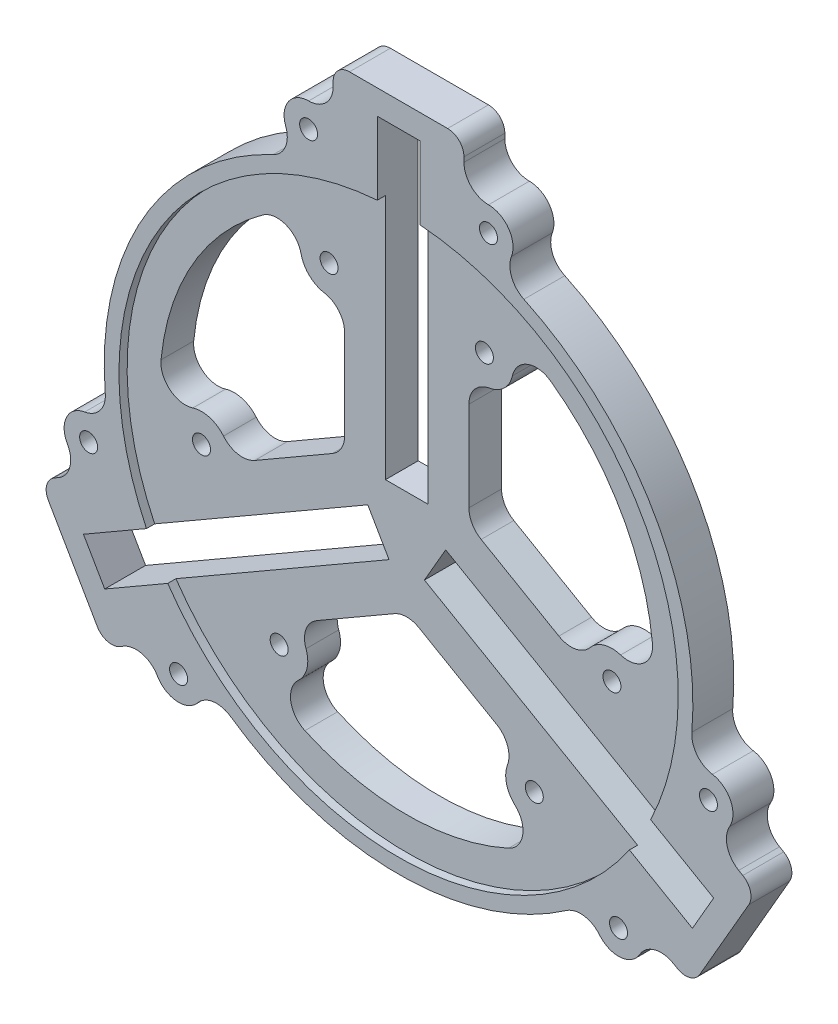
from build123d import *

# Parameters (mm, degrees)
SKETCH1_W           = 5.2
SKETCH1_H           = 39
BOSS_EXTRUDE1_DEPTH = 5
BOSS_EXTRUDE2_DEPTH = 5
SKETCH3_R           = 34.2
CUT_EXTRUDE1_DEPTH  = 1
CUT_EXTRUDE2_REACH  = 65.739
SKETCH4_R           = 1.1
FILLET1_R           = 2
CUT_EXTRUDE3_REACH  = 65.167
FILLET2_R           = 3
SKETCH6_R           = 1.1
BOSS_EXTRUDE3_DEPTH = 5
FILLET3_R           = 3


with BuildPart() as part:
    # Sketch1 → Boss-Extrude1 (new body)
    with BuildSketch(Plane.XY):
        Polygon((-8, 46), (8, 46), (8, 35), (34.310889132, -10.57179677), (43.837168574, -16.07179677), (35.837168574, -29.92820323), (26.310889132, -24.42820323), (-26.310889132, -24.42820323), (-35.837168574, -29.92820323), (-43.837168574, -16.07179677), (-34.310889132, -10.57179677), (-8, 35), align=None)
        Polygon((4.764101615, 0.25166605), (2.164101615, -4.25166605), (35.939092363, -23.75166605), (38.539092363, -19.24833395), align=None, mode=Mode.SUBTRACT)
        with Locations((0, 23.5)):
            Rectangle(SKETCH1_W, SKETCH1_H, mode=Mode.SUBTRACT)
        Polygon((-2.164101615, -4.25166605), (-4.764101615, 0.25166605), (-38.539092363, -19.24833395), (-35.939092363, -23.75166605), align=None, mode=Mode.SUBTRACT)
    extrude(amount=BOSS_EXTRUDE1_DEPTH)

    # Sketch2 → Boss-Extrude2 (add)
    with BuildSketch(Plane.XY.offset(5)):
        with BuildLine():
            Line((34.310889132, -10.57179677), (8, 35))
            Line((8, 35), (8, 35.09985755))
            ThreePointArc((8, 35.09985755), (31.176914536, 18), (34.397368307, -10.621725545))
            Line((34.397368307, -10.621725545), (34.310889132, -10.57179677))
        make_face()
        with BuildLine():
            Line((-26.310889132, -24.42820323), (26.310889132, -24.42820323))
            Line((26.310889132, -24.42820323), (26.397368307, -24.478132005))
            ThreePointArc((26.397368307, -24.478132005), (0, -36), (-26.397368307, -24.478132005))
            Line((-26.397368307, -24.478132005), (-26.310889132, -24.42820323))
        make_face()
        with BuildLine():
            Line((-8, 35), (-34.310889132, -10.57179677))
            Line((-34.310889132, -10.57179677), (-34.397368307, -10.621725545))
            ThreePointArc((-34.397368307, -10.621725545), (-31.176914536, 18), (-8, 35.09985755))
            Line((-8, 35.09985755), (-8, 35))
        make_face()
    extrude(amount=-BOSS_EXTRUDE2_DEPTH)

    # Sketch3 → Cut-Extrude1 (cut)
    with BuildSketch(Plane.XY.offset(5)):
        Circle(SKETCH3_R)
    extrude(amount=-CUT_EXTRUDE1_DEPTH, mode=Mode.SUBTRACT)

    # Sketch4 → Cut-Extrude2 (cut, up to next)
    with BuildSketch(Plane(origin=(0, 0, 0), x_dir=(-1, 0, 0), z_dir=(0, 0, -1)), mode=Mode.PRIVATE) as cut_extrude2_sk1:
        with Locations((9.5, 23.5)):
            Circle(SKETCH4_R)
    cut_extrude2_tool1 = extrude(cut_extrude2_sk1.sketch, amount=-CUT_EXTRUDE2_REACH, mode=Mode.PRIVATE) & part.part
    # Sketch4 → Cut-Extrude2 (cut, up to next)
    with BuildSketch(Plane(origin=(0, 0, 0), x_dir=(-1, 0, 0), z_dir=(0, 0, -1)), mode=Mode.PRIVATE) as cut_extrude2_sk2:
        with Locations((-9.5, 23.5)):
            Circle(SKETCH4_R)
    cut_extrude2_tool2 = extrude(cut_extrude2_sk2.sketch, amount=-CUT_EXTRUDE2_REACH, mode=Mode.PRIVATE) & part.part
    # Sketch4 → Cut-Extrude2 (cut, up to next)
    with BuildSketch(Plane(origin=(0, 0, 0), x_dir=(-1, 0, 0), z_dir=(0, 0, -1)), mode=Mode.PRIVATE) as cut_extrude2_sk3:
        with Locations((-25.101596989, -3.522758664)):
            Circle(SKETCH4_R)
    cut_extrude2_tool3 = extrude(cut_extrude2_sk3.sketch, amount=-CUT_EXTRUDE2_REACH, mode=Mode.PRIVATE) & part.part
    # Sketch4 → Cut-Extrude2 (cut, up to next)
    with BuildSketch(Plane(origin=(0, 0, 0), x_dir=(-1, 0, 0), z_dir=(0, 0, -1)), mode=Mode.PRIVATE) as cut_extrude2_sk4:
        with Locations((-15.601596989, -19.977241336)):
            Circle(SKETCH4_R)
    cut_extrude2_tool4 = extrude(cut_extrude2_sk4.sketch, amount=-CUT_EXTRUDE2_REACH, mode=Mode.PRIVATE) & part.part
    # Sketch4 → Cut-Extrude2 (cut, up to next)
    with BuildSketch(Plane(origin=(0, 0, 0), x_dir=(-1, 0, 0), z_dir=(0, 0, -1)), mode=Mode.PRIVATE) as cut_extrude2_sk5:
        with Locations((15.601596989, -19.977241336)):
            Circle(SKETCH4_R)
    cut_extrude2_tool5 = extrude(cut_extrude2_sk5.sketch, amount=-CUT_EXTRUDE2_REACH, mode=Mode.PRIVATE) & part.part
    # Sketch4 → Cut-Extrude2 (cut, up to next)
    with BuildSketch(Plane(origin=(0, 0, 0), x_dir=(-1, 0, 0), z_dir=(0, 0, -1)), mode=Mode.PRIVATE) as cut_extrude2_sk6:
        with Locations((25.101596989, -3.522758664)):
            Circle(SKETCH4_R)
    cut_extrude2_tool6 = extrude(cut_extrude2_sk6.sketch, amount=-CUT_EXTRUDE2_REACH, mode=Mode.PRIVATE) & part.part
    add(cut_extrude2_tool1.solids().sort_by_distance((-9.5, 23.5, 0))[0], mode=Mode.SUBTRACT)
    add(cut_extrude2_tool2.solids().sort_by_distance((9.5, 23.5, 0))[0], mode=Mode.SUBTRACT)
    add(cut_extrude2_tool3.solids().sort_by_distance((25.101597, -3.522759, 0))[0], mode=Mode.SUBTRACT)
    add(cut_extrude2_tool4.solids().sort_by_distance((15.601597, -19.977241, 0))[0], mode=Mode.SUBTRACT)
    add(cut_extrude2_tool5.solids().sort_by_distance((-15.601597, -19.977241, 0))[0], mode=Mode.SUBTRACT)
    add(cut_extrude2_tool6.solids().sort_by_distance((-25.101597, -3.522759, 0))[0], mode=Mode.SUBTRACT)

    # Fillet1
    fillet1_edges = [part.edges().sort_by_distance(p)[0] for p in [
        (43.837168574, -16.07179677, 2.5),
        (35.837168574, -29.92820323, 2.5),
        (-35.837168574, -29.92820323, 2.5),
        (-43.837168574, -16.07179677, 2.5),
        (-8, 46, 2.5),
        (8, 46, 2.5),
    ]]
    fillet(fillet1_edges, radius=FILLET1_R)

    # Sketch5 → Cut-Extrude3 (cut, up to next)
    with BuildSketch(Plane.XY.offset(4), mode=Mode.PRIVATE) as cut_extrude3_sk1:
        with BuildLine():
            Line((0, -8.775724092), (14.006012577, -16.862099223))
            ThreePointArc((14.006012577, -16.862099223), (12.10270106, -19.889336396), (13.851596989, -23.008330249))
            Line((13.851596989, -23.008330249), (17.106778687, -24.887710279))
            ThreePointArc((17.106778687, -24.887710279), (0, -30.2), (-17.106778687, -24.887710279))
            Line((-17.106778687, -24.887710279), (-13.851596989, -23.008330249))
            ThreePointArc((-13.851596989, -23.008330249), (-12.10270106, -19.889336396), (-14.006012577, -16.862099223))
            Line((-14.006012577, -16.862099223), (0, -8.775724092))
        make_face()
    cut_extrude3_tool1 = extrude(cut_extrude3_sk1.sketch, amount=-CUT_EXTRUDE3_REACH, mode=Mode.PRIVATE) & part.part
    # Sketch5 → Cut-Extrude3 (cut, up to next)
    with BuildSketch(Plane.XY.offset(4), mode=Mode.PRIVATE) as cut_extrude3_sk2:
        with BuildLine():
            Line((-7.6, 4.387862046), (-21.606012577, -3.698513086))
            ThreePointArc((-21.606012577, -3.698513086), (-23.276021113, -0.536578375), (-26.851596989, -0.491669751))
            Line((-26.851596989, -0.491669751), (-30.106778687, -2.371049781))
            ThreePointArc((-30.106778687, -2.371049781), (-26.153967194, 15.1), (-13, 27.25876006))
            Line((-13, 27.25876006), (-13, 23.5))
            ThreePointArc((-13, 23.5), (-11.173320053, 20.42591477), (-7.6, 20.560612309))
            Line((-7.6, 20.560612309), (-7.6, 4.387862046))
        make_face()
    cut_extrude3_tool2 = extrude(cut_extrude3_sk2.sketch, amount=-CUT_EXTRUDE3_REACH, mode=Mode.PRIVATE) & part.part
    # Sketch5 → Cut-Extrude3 (cut, up to next)
    with BuildSketch(Plane.XY.offset(4), mode=Mode.PRIVATE) as cut_extrude3_sk3:
        with BuildLine():
            Line((7.6, 4.387862046), (7.6, 20.560612309))
            ThreePointArc((7.6, 20.560612309), (11.173320053, 20.42591477), (13, 23.5))
            Line((13, 23.5), (13, 27.25876006))
            ThreePointArc((13, 27.25876006), (26.153967194, 15.1), (30.106778687, -2.371049781))
            Line((30.106778687, -2.371049781), (26.851596989, -0.491669751))
            ThreePointArc((26.851596989, -0.491669751), (23.276021113, -0.536578375), (21.606012577, -3.698513086))
            Line((21.606012577, -3.698513086), (7.6, 4.387862046))
        make_face()
    cut_extrude3_tool3 = extrude(cut_extrude3_sk3.sketch, amount=-CUT_EXTRUDE3_REACH, mode=Mode.PRIVATE) & part.part
    add(cut_extrude3_tool1.solids().sort_by_distance((0, -20.951197, 4))[0], mode=Mode.SUBTRACT)
    add(cut_extrude3_tool2.solids().sort_by_distance((-18.144269, 10.475599, 4))[0], mode=Mode.SUBTRACT)
    add(cut_extrude3_tool3.solids().sort_by_distance((18.144269, 10.475599, 4))[0], mode=Mode.SUBTRACT)

    # Fillet2
    fillet2_edges = [part.edges().sort_by_distance(p)[0] for p in [
        (0, -8.775724092, 2),
        (14.006012577, -16.862099223, 2),
        (17.106778687, -24.887710279, 2),
        (-17.106778687, -24.887710279, 2),
        (-14.006012577, -16.862099223, 2),
        (13, 27.25876006, 2),
        (30.106778687, -2.371049781, 2),
        (21.606012577, -3.698513086, 2),
        (7.6, 4.387862046, 2),
        (7.6, 20.560612309, 2),
        (-30.106778687, -2.371049781, 2),
        (-21.606012577, -3.698513086, 2),
        (-7.6, 4.387862046, 2),
        (-7.6, 20.560612309, 2),
        (-13, 27.25876006, 2),
    ]]
    fillet(fillet2_edges, radius=FILLET2_R)

    # Sketch6 → Boss-Extrude3 (add)
    # profile 1 of 6: a face of its own
    with BuildSketch(Plane.XY.offset(5)):
        with BuildLine():
            Line((-11, 40.416573868), (-8, 40.416573868))
            Line((-8, 40.416573868), (-8, 35.09985755))
            ThreePointArc((-8, 35.09985755), (-10.415364961, 34.460414576), (-12.780558762, 33.654974636))
            Line((-12.780558762, 33.654974636), (-13.80458122, 36.351527304))
            ThreePointArc((-13.80458122, 36.351527304), (-13.469325788, 39.120225873), (-11, 40.416573868))
        make_face()
        with Locations((-11, 37.416573868)):
            Circle(SKETCH6_R, mode=Mode.SUBTRACT)
    # profile 2 of 6: a face of its own
    with BuildSketch(Plane.XY.offset(5)):
        with BuildLine():
            Line((8, 40.416573868), (8, 35.09985755))
            ThreePointArc((8, 35.09985755), (10.415364961, 34.460414576), (12.780558762, 33.654974636))
            Line((12.780558762, 33.654974636), (13.80458122, 36.351527304))
            ThreePointArc((13.80458122, 36.351527304), (13.469325788, 39.120225873), (11, 40.416573868))
            Line((11, 40.416573868), (8, 40.416573868))
        make_face()
        with Locations((11, 37.416573868)):
            Circle(SKETCH6_R, mode=Mode.SUBTRACT)
    # profile 3 of 6: a face of its own
    with BuildSketch(Plane.XY.offset(5)):
        with BuildLine():
            Line((40.501779703, -10.682007492), (39.001779703, -13.280083704))
            Line((39.001779703, -13.280083704), (34.397368307, -10.621725545))
            ThreePointArc((34.397368307, -10.621725545), (35.051276928, -8.210236642), (35.536342379, -5.759198755))
            Line((35.536342379, -5.759198755), (38.383636722, -6.220645627))
            ThreePointArc((38.383636722, -6.220645627), (40.613772302, -7.895334633), (40.501779703, -10.682007492))
        make_face()
        with Locations((37.903703492, -9.182007492)):
            Circle(SKETCH6_R, mode=Mode.SUBTRACT)
    # profile 4 of 6: a face of its own
    with BuildSketch(Plane.XY.offset(5)):
        with BuildLine():
            Line((31.001779703, -27.136490164), (26.397368307, -24.478132005))
            ThreePointArc((26.397368307, -24.478132005), (24.635911967, -26.250177934), (22.755783617, -27.89577588))
            Line((22.755783617, -27.89577588), (24.579055502, -30.130881677))
            ThreePointArc((24.579055502, -30.130881677), (27.144446514, -31.22489124), (29.501779703, -29.734566375))
            Line((29.501779703, -29.734566375), (31.001779703, -27.136490164))
        make_face()
        with Locations((26.903703492, -28.234566375)):
            Circle(SKETCH6_R, mode=Mode.SUBTRACT)
    # profile 5 of 6: a face of its own
    with BuildSketch(Plane.XY.offset(5)):
        with BuildLine():
            Line((-29.501779703, -29.734566375), (-31.001779703, -27.136490164))
            Line((-31.001779703, -27.136490164), (-26.397368307, -24.478132005))
            ThreePointArc((-26.397368307, -24.478132005), (-24.635911967, -26.250177934), (-22.755783617, -27.89577588))
            Line((-22.755783617, -27.89577588), (-24.579055502, -30.130881677))
            ThreePointArc((-24.579055502, -30.130881677), (-27.144446514, -31.22489124), (-29.501779703, -29.734566375))
        make_face()
        with Locations((-26.903703492, -28.234566375)):
            Circle(SKETCH6_R, mode=Mode.SUBTRACT)
    # profile 6 of 6: a face of its own
    with BuildSketch(Plane.XY.offset(5)):
        with BuildLine():
            Line((-39.001779703, -13.280083704), (-34.397368307, -10.621725545))
            ThreePointArc((-34.397368307, -10.621725545), (-35.051276928, -8.210236642), (-35.536342379, -5.759198755))
            Line((-35.536342379, -5.759198755), (-38.383636722, -6.220645627))
            ThreePointArc((-38.383636722, -6.220645627), (-40.613772302, -7.895334633), (-40.501779703, -10.682007492))
            Line((-40.501779703, -10.682007492), (-39.001779703, -13.280083704))
        make_face()
        with Locations((-37.903703492, -9.182007492)):
            Circle(SKETCH6_R, mode=Mode.SUBTRACT)
    extrude(amount=-BOSS_EXTRUDE3_DEPTH)

    # Fillet3
    fillet3_edges = [part.edges().sort_by_distance(p)[0] for p in [
        (12.780558762, 33.654974636, 2.5),
        (8, 40.416573868, 2.5),
        (-12.780558762, 33.654974636, 2.5),
        (-8, 40.416573868, 2.5),
        (-39.001779703, -13.280083704, 2.5),
        (-35.536342379, -5.759198755, 2.5),
        (39.001779703, -13.280083704, 2.5),
        (35.536342379, -5.759198755, 2.5),
        (31.001779703, -27.136490164, 2.5),
        (22.755783617, -27.89577588, 2.5),
        (-31.001779703, -27.136490164, 2.5),
        (-22.755783617, -27.89577588, 2.5),
    ]]
    fillet(fillet3_edges, radius=FILLET3_R - 0.0001)  # a hair under: the kernel refuses the full size


solid = part.part
